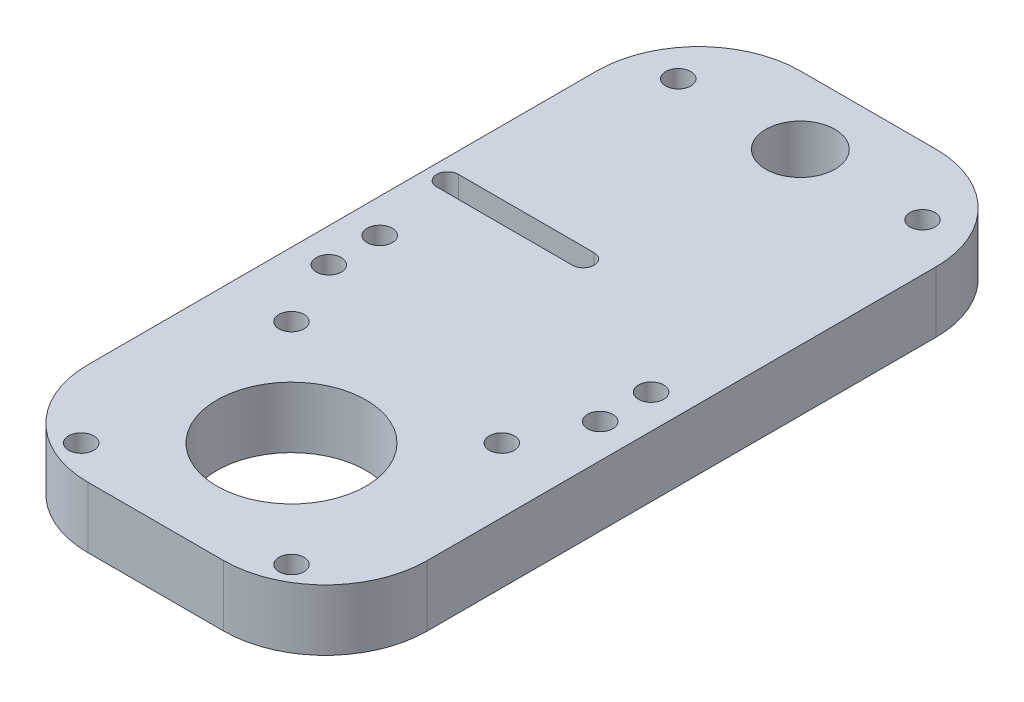
from build123d import *

# Parameters (mm, degrees)
SKETCH1_W           = 50
SKETCH1_H           = 105
BOSS_EXTRUDE1_DEPTH = 9
SKETCH2_R           = 11
SKETCH2_R_2         = 1.85
SKETCH2_R_3         = 5.1
CUT_EXTRUDE1_DEPTH  = 9
SKETCH3_R           = 1.85
CUT_EXTRUDE4_DEPTH  = 10
FILLET1_R           = 15


with BuildPart() as part:
    # Sketch1 → Boss-Extrude1 (new body)
    with BuildSketch(Plane(origin=(0, 0, 0), x_dir=(1, 0, 0), z_dir=(0, 1, 0))):
        with Locations((34.488967371, 40.084311239)):
            Rectangle(SKETCH1_W, SKETCH1_H)
    extrude(amount=BOSS_EXTRUDE1_DEPTH)

    # Sketch2 → Cut-Extrude1 (cut)
    with BuildSketch(Plane(origin=(0, 9, 0), x_dir=(1, 0, 0), z_dir=(0, 1, 0))):
        with Locations((34.488967371, 7.584311239)):
            Circle(SKETCH2_R)
        with Locations((49.988967371, 23.084311239)):
            Circle(SKETCH2_R_2)
        with Locations((18.988967371, -7.915688761)):
            Circle(SKETCH2_R_2)
        with Locations((49.988967371, -7.915688761)):
            Circle(SKETCH2_R_2)
        with Locations((18.988967371, 23.084311239)):
            Circle(SKETCH2_R_2)
        with Locations((52.488967371, 82.584311239)):
            Circle(SKETCH2_R_2)
        with Locations((34.488967371, 82.584311239)):
            Circle(SKETCH2_R_3)
        with Locations((16.488967371, 82.584311239)):
            Circle(SKETCH2_R_2)
        with BuildLine():
            Line((32.488967371, 50.984311239), (12.488967371, 50.984311239))
            ThreePointArc((12.488967371, 50.984311239), (10.888967371, 52.584311239), (12.488967371, 54.184311239))
            Line((12.488967371, 54.184311239), (32.488967371, 54.184311239))
            ThreePointArc((32.488967371, 54.184311239), (34.088967371, 52.584311239), (32.488967371, 50.984311239))
        make_face()
    extrude(amount=-CUT_EXTRUDE1_DEPTH, mode=Mode.SUBTRACT)

    # Sketch3 → Cut-Extrude4 (cut)
    with BuildSketch(Plane(origin=(0, 9, 0), x_dir=(1, 0, 0), z_dir=(0, 1, 0))):
        with Locations((14.488967371, 40.584311239)):
            Circle(SKETCH3_R)
        with Locations((54.488967371, 40.584311239)):
            Circle(SKETCH3_R)
        with Locations((54.488967371, 33.084311239)):
            Circle(SKETCH3_R)
        with Locations((14.488967371, 33.084311239)):
            Circle(SKETCH3_R)
    extrude(amount=-CUT_EXTRUDE4_DEPTH, mode=Mode.SUBTRACT)

    # Fillet1
    fillet1_edges = [part.edges().sort_by_distance(p)[0] for p in [
        (59.488967371, 4.5, 12.415688761),
        (9.488967371, 4.5, 12.415688761),
        (59.488967371, 4.5, -92.584311239),
        (9.488967371, 4.5, -92.584311239),
    ]]
    fillet(fillet1_edges, radius=FILLET1_R)


solid = part.part
